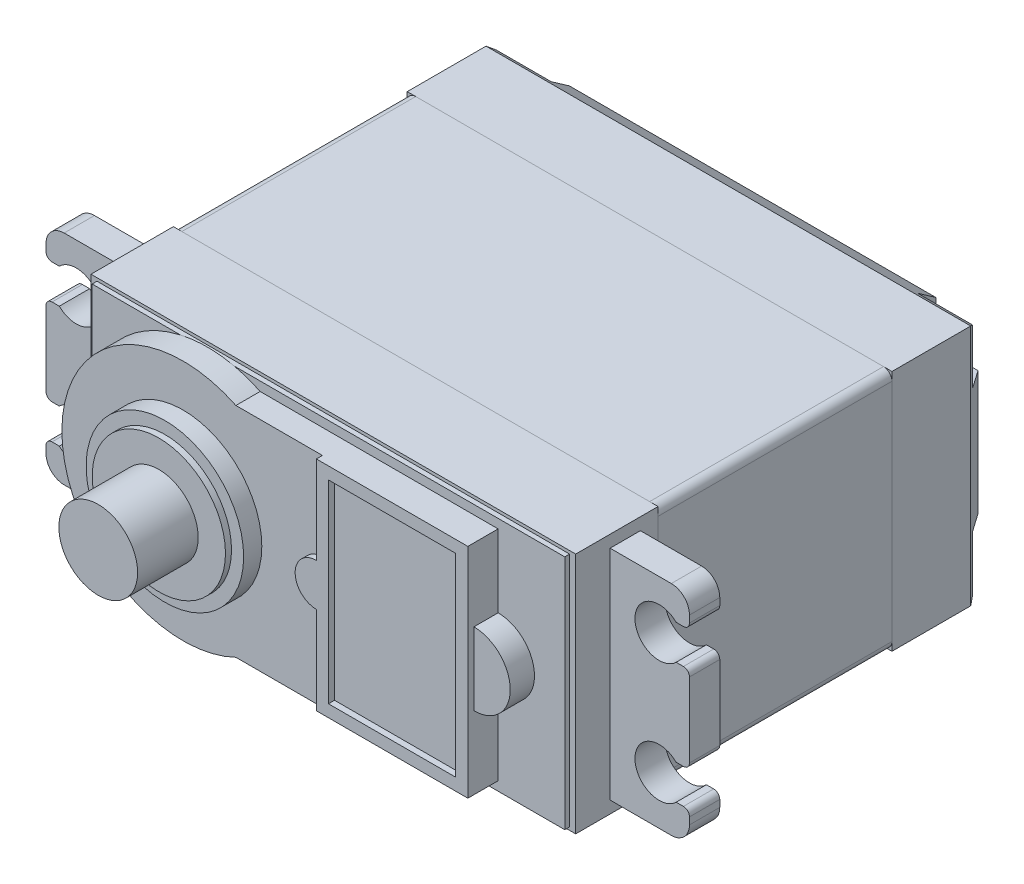
from build123d import *
from OCP.BRepFilletAPI import BRepFilletAPI_MakeChamfer

# Parameters (mm, degrees)
SKETCH1_W            = 40
SKETCH1_H            = 20
BOSS_EXTRUDE1_DEPTH  = 19.3
SKETCH2_W            = 40
SKETCH2_H            = 20
BOSS_EXTRUDE2_DEPTH  = 6.8
SKETCH3_W            = 40
SKETCH3_H            = 20
BOSS_EXTRUDE3_DEPTH  = 8.5
CHAMFER1_SIZE        = 2
CHAMFER1_SIZE2       = 1.400415076
CUT_EXTRUDE1_DEPTH   = 1.5
SKETCH5_W            = 39
SKETCH5_H            = 19.5
BOSS_EXTRUDE5_DEPTH  = 0.4
BOSS_EXTRUDE6_DEPTH  = 2
SKETCH7_R            = 6.5
BOSS_EXTRUDE7_DEPTH  = 1.5
SKETCH8_R            = 5.5
BOSS_EXTRUDE8_DEPTH  = 0.5
SKETCH9_R            = 3.25
BOSS_EXTRUDE9_DEPTH  = 5
SKETCH10_W           = 10.5
SKETCH10_H           = 15.998933302
BOSS_EXTRUDE10_DEPTH = 0.5
FILLET1_R            = 0.7
BOSS_EXTRUDE11_START = -5.74
BOSS_EXTRUDE11_DEPTH = 2.5


with BuildPart() as part:
    # Sketch1 → Boss-Extrude1 (new body)
    with BuildSketch(Plane.XY):
        Rectangle(SKETCH1_W, SKETCH1_H)
    extrude(amount=BOSS_EXTRUDE1_DEPTH)

    # Fillet1
    fillet1_edges = [part.edges().sort_by_distance(p)[0] for p in [
        (20, -10, 9.65),
        (20, 10, 9.65),
        (-20, -10, 9.65),
        (-20, 10, 9.65),
    ]]
    fillet(fillet1_edges, radius=FILLET1_R)


with BuildPart() as body_2:
    # Sketch2 → Boss-Extrude2 (new body)
    with BuildSketch(Plane.XY.offset(19.3)):
        Rectangle(SKETCH2_W, SKETCH2_H)
    extrude(amount=BOSS_EXTRUDE2_DEPTH)

    # Sketch5 → Boss-Extrude5 (add)
    with BuildSketch(Plane.XY.offset(26.1)):
        Rectangle(SKETCH5_W, SKETCH5_H)
    extrude(amount=BOSS_EXTRUDE5_DEPTH)

    # Sketch6 → Boss-Extrude6 (add)
    with BuildSketch(Plane.XY.offset(26.5)):
        with BuildLine():
            Line((-5.64, 8.999466651), (14, 8.999466651))
            Line((14, 8.999466651), (14, 3))
            ThreePointArc((14, 3), (17, 0), (14, -3))
            Line((14, -3), (14, -8.999466651))
            Line((14, -8.999466651), (-5.64, -8.999466651))
            ThreePointArc((-5.64, -8.999466651), (-20, 0), (-5.64, 8.999466651))
        make_face()
    extrude(amount=BOSS_EXTRUDE6_DEPTH)

    # Sketch7 → Boss-Extrude7 (add)
    with BuildSketch(Plane.XY.offset(28.5)):
        with Locations((-10, 0)):
            Circle(SKETCH7_R)
    extrude(amount=BOSS_EXTRUDE7_DEPTH)

    # Sketch8 → Boss-Extrude8 (add)
    with BuildSketch(Plane.XY.offset(30)):
        with Locations((-10, 0)):
            Circle(SKETCH8_R)
    extrude(amount=BOSS_EXTRUDE8_DEPTH)

    # Sketch9 → Boss-Extrude9 (add)
    with BuildSketch(Plane.XY.offset(30.5)):
        with Locations((-10, 0)):
            Circle(SKETCH9_R)
    extrude(amount=BOSS_EXTRUDE9_DEPTH)

    # Sketch10 → Boss-Extrude10 (add)
    with BuildSketch(Plane.XY.offset(28.5)):
        with BuildLine():
            Line((14, 8.999466651), (1.5, 8.999466651))
            Line((1.5, 8.999466651), (1.5, 1.75))
            ThreePointArc((1.5, 1.75), (-0.25, 0), (1.5, -1.75))
            Line((1.5, -1.75), (1.5, -8.999466651))
            Line((1.5, -8.999466651), (14, -8.999466651))
            Line((14, -8.999466651), (14, 8.999466651))
        make_face()
        with Locations((7.75, 0)):
            Rectangle(SKETCH10_W, SKETCH10_H, mode=Mode.SUBTRACT)
    extrude(amount=BOSS_EXTRUDE10_DEPTH)

    # Sketch11 → Boss-Extrude11 (add)
    with BuildSketch(Plane.XY.offset(26.5).offset(BOSS_EXTRUDE11_START)):
        with BuildLine():
            Line((20, 9), (25.05, 9))
            ThreePointArc((25.05, 9), (26.110660172, 8.560660172), (26.55, 7.5))
            Line((26.55, 7.5), (26.55, 6.928285686))
            ThreePointArc((26.55, 6.928285686), (26.403553391, 6.574732295), (26.05, 6.428285686))
            Line((26.05, 6.428285686), (25.45, 6.428285686))
            ThreePointArc((25.45, 6.428285686), (22.05, 5), (25.45, 3.571714314))
            Line((25.45, 3.571714314), (26.05, 3.571714314))
            ThreePointArc((26.05, 3.571714314), (26.403553391, 3.425267705), (26.55, 3.071714314))
            Line((26.55, 3.071714314), (26.55, -3.071714314))
            ThreePointArc((26.55, -3.071714314), (26.403553391, -3.425267705), (26.05, -3.571714314))
            Line((26.05, -3.571714314), (25.45, -3.571714314))
            ThreePointArc((25.45, -3.571714314), (22.05, -5), (25.45, -6.428285686))
            Line((25.45, -6.428285686), (26.05, -6.428285686))
            ThreePointArc((26.05, -6.428285686), (26.403553391, -6.574732295), (26.55, -6.928285686))
            Line((26.55, -6.928285686), (26.55, -7.5))
            ThreePointArc((26.55, -7.5), (26.110660172, -8.560660172), (25.05, -9))
            Line((25.05, -9), (20, -9))
            Line((20, -9), (20, 9))
        make_face()
    boss_extrude11 = extrude(amount=BOSS_EXTRUDE11_DEPTH)

    # Mirror1: Boss-Extrude11 across plane
    add(boss_extrude11.mirror(Plane(origin=(0, 0, 0), x_dir=(0, 0, 1), z_dir=(1, 0, 0))))


with BuildPart() as body_3:
    # Sketch3 → Boss-Extrude3 (new body)
    with BuildSketch(Plane(origin=(0, 0, 0), x_dir=(-1, 0, 0), z_dir=(0, 0, -1))):
        Rectangle(SKETCH3_W, SKETCH3_H)
    extrude(amount=BOSS_EXTRUDE3_DEPTH)

    # Chamfer1: one chamfer whose edges measure the first distance from different faces: ONE call of the kernel's chamfer builder (chamfer() names one face for all edges)
    chamfer1_edges_1 = [body_3.edges().sort_by_distance(p)[0] for p in [
        (-20, 0, -8.5),
    ]]
    chamfer1_side_1 = [body_3.faces().sort_by_distance(p)[0] for p in [
        (-20, 0, -4.25),
    ]]
    chamfer1_edges_2 = [body_3.edges().sort_by_distance(p)[0] for p in [
        (0, -10, -8.5),
    ]]
    chamfer1_side_2 = [body_3.faces().sort_by_distance(p)[0] for p in [
        (0, -10, -4.25),
    ]]
    chamfer1_edges_3 = [body_3.edges().sort_by_distance(p)[0] for p in [
        (20, 0, -8.5),
    ]]
    chamfer1_side_3 = [body_3.faces().sort_by_distance(p)[0] for p in [
        (20, 0, -4.25),
    ]]
    chamfer1_edges_4 = [body_3.edges().sort_by_distance(p)[0] for p in [
        (0, 10, -8.5),
    ]]
    chamfer1_side_4 = [body_3.faces().sort_by_distance(p)[0] for p in [
        (0, 10, -4.25),
    ]]
    chamfer1 = BRepFilletAPI_MakeChamfer(body_3.part.solid().wrapped)
    for e in chamfer1_edges_1:
        chamfer1.Add(CHAMFER1_SIZE, CHAMFER1_SIZE2, e.wrapped, chamfer1_side_1[0].wrapped)  # the first distance lies on this face
    for e in chamfer1_edges_2:
        chamfer1.Add(CHAMFER1_SIZE, CHAMFER1_SIZE2, e.wrapped, chamfer1_side_2[0].wrapped)  # the first distance lies on this face
    for e in chamfer1_edges_3:
        chamfer1.Add(CHAMFER1_SIZE, CHAMFER1_SIZE2, e.wrapped, chamfer1_side_3[0].wrapped)  # the first distance lies on this face
    for e in chamfer1_edges_4:
        chamfer1.Add(CHAMFER1_SIZE, CHAMFER1_SIZE2, e.wrapped, chamfer1_side_4[0].wrapped)  # the first distance lies on this face
    add(Compound.cast(chamfer1.Shape()), mode=Mode.REPLACE)

    # Sketch4 → Cut-Extrude1 (cut)
    with BuildSketch(Plane(origin=(0, 0, -8.5), x_dir=(-1, 0, 0), z_dir=(0, 0, -1))):
        with BuildLine():
            Line((-20, 10), (-15.12, 10))
            Line((-15.12, 10), (-15.12, 7.115114037))
            ThreePointArc((-15.12, 7.115114037), (-15.705786438, 5.700900474), (-17.12, 5.115114037))
            Line((-17.12, 5.115114037), (-20, 5.115114037))
            Line((-20, 5.115114037), (-20, 10))
        make_face()
        with BuildLine():
            Line((20, 5.115114037), (17.12, 5.115114037))
            ThreePointArc((17.12, 5.115114037), (15.705786438, 5.700900474), (15.12, 7.115114037))
            Line((15.12, 7.115114037), (15.12, 10))
            Line((15.12, 10), (20, 10))
            Line((20, 10), (20, 5.115114037))
        make_face()
        with BuildLine():
            Line((20, -10), (20, -5.115114037))
            Line((20, -5.115114037), (17.12, -5.115114037))
            ThreePointArc((17.12, -5.115114037), (15.705786438, -5.700900474), (15.12, -7.115114037))
            Line((15.12, -7.115114037), (15.12, -10))
            Line((15.12, -10), (20, -10))
        make_face()
        with BuildLine():
            Line((-20, -5.115114037), (-17.12, -5.115114037))
            ThreePointArc((-17.12, -5.115114037), (-15.705786438, -5.700900474), (-15.12, -7.115114037))
            Line((-15.12, -7.115114037), (-15.12, -10))
            Line((-15.12, -10), (-20, -10))
            Line((-20, -10), (-20, -5.115114037))
        make_face()
    extrude(amount=-CUT_EXTRUDE1_DEPTH, mode=Mode.SUBTRACT)


solid = Compound([part.part, body_2.part, body_3.part])
